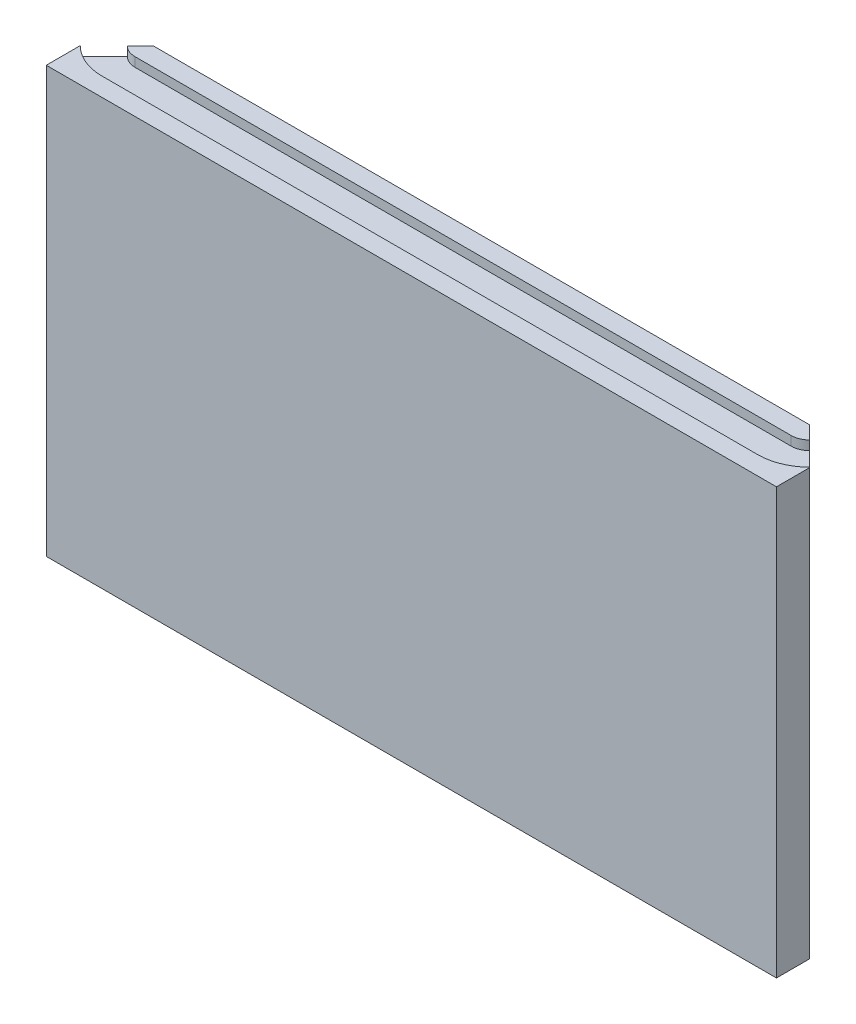
from build123d import *

# Parameters (mm, degrees)
SKETCH1_W           = 197.4
SKETCH1_H           = 115
BOSS_EXTRUDE1_DEPTH = 9
BOSS_EXTRUDE2_DEPTH = 10
CUT_EXTRUDE3_DEPTH  = 2.5


with BuildPart() as part:
    # Sketch1 → Boss-Extrude1 (new body)
    with BuildSketch(Plane.XY):
        Rectangle(SKETCH1_W, SKETCH1_H)
    extrude(amount=BOSS_EXTRUDE1_DEPTH)

    # Sketch2 → Boss-Extrude2 (add)
    with BuildSketch(Plane(origin=(0, 57.5, 0), x_dir=(1, 0, 0), z_dir=(0, 1, 0))):
        Polygon((-88.7, 10), (88.7, 10), (98.7, 0), (-98.7, 0), align=None)
    boss_extrude2 = extrude(amount=-BOSS_EXTRUDE2_DEPTH)

    # Sketch5 → Cut-Extrude3 (cut)
    with BuildSketch(Plane(origin=(0, 57.5, 0), x_dir=(1, 0, 0), z_dir=(0, 1, 0))):
        with BuildLine():
            Line((-88.7, 5), (88.7, 5))
            ThreePointArc((88.7, 5), (90.613417162, 5.380602337), (92.235533906, 6.464466094))
            Line((92.235533906, 6.464466094), (98.599494937, 0.100505063))
            ThreePointArc((98.599494937, 0.100505063), (94.057568053, -2.934313455), (88.7, -4))
            Line((88.7, -4), (-88.7, -4))
            ThreePointArc((-88.7, -4), (-94.057568053, -2.934313455), (-98.599494937, 0.100505063))
            Line((-98.599494937, 0.100505063), (-92.235533906, 6.464466094))
            ThreePointArc((-92.235533906, 6.464466094), (-90.613417162, 5.380602337), (-88.7, 5))
        make_face()
    cut_extrude3 = extrude(amount=-CUT_EXTRUDE3_DEPTH, mode=Mode.SUBTRACT)

    # Mirror2: Boss-Extrude2, Cut-Extrude3 across plane
    add(boss_extrude2.mirror(Plane.ZX))
    add(cut_extrude3.mirror(Plane.ZX), mode=Mode.SUBTRACT)


solid = part.part
